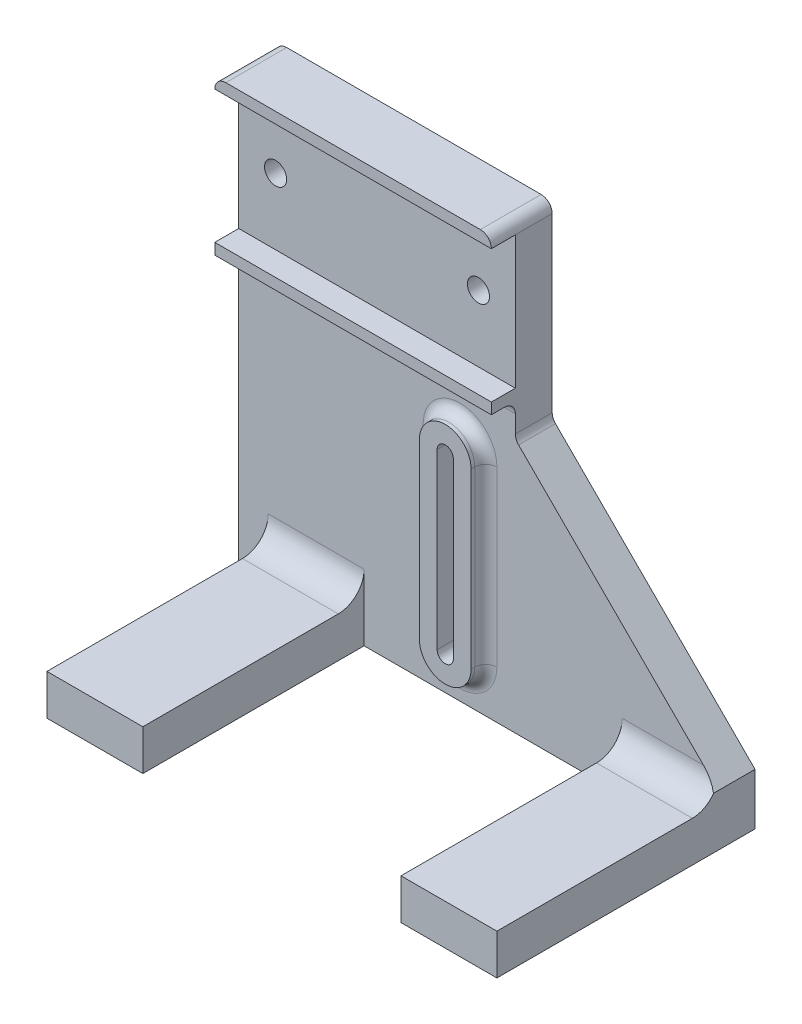
from build123d import *

# Parameters (mm, degrees)
BOSS_EXTRUDE1_DEPTH = 10
SKETCH3_W           = 75
SKETCH3_H           = 3
BOSS_EXTRUDE2_DEPTH = 6.5
SKETCH4_R           = 3
CUT_EXTRUDE2_DEPTH  = 10
SKETCH5_W           = 26
SKETCH5_H           = 11
BOSS_EXTRUDE3_DEPTH = 60
BOSS_EXTRUDE5_DEPTH = 4
CUT_EXTRUDE3_DEPTH  = 186.569394028
FILLET2_START       = -10
FILLET2_DEPTH       = 10
FILLET2_2_DEPTH     = 75
FILLET2_START_2     = -11
FILLET2_3_DEPTH     = 18
CUT_EXTRUDE5_DEPTH  = 7.75
FILLET4_R           = 3
FILLET5_R           = 7


with BuildPart() as part:
    # Sketch2 → Boss-Extrude1 (new body)
    with BuildSketch(Plane.XY):
        Polygon((0, 0), (130, 0), (130, 14), (75, 69), (75, 120), (0, 120), align=None)
    extrude(amount=-BOSS_EXTRUDE1_DEPTH)

    # Sketch3 → Boss-Extrude2 (add)
    with BuildSketch(Plane.XY):
        with Locations((37.5, 118.5)):
            Rectangle(SKETCH3_W, SKETCH3_H)
        with Locations((37.5, 79.5)):
            Rectangle(SKETCH3_W, SKETCH3_H)
    extrude(amount=BOSS_EXTRUDE2_DEPTH)

    # Sketch4 → Cut-Extrude2 (cut)
    with BuildSketch(Plane.XY):
        with Locations((10, 99)):
            Circle(SKETCH4_R)
        with Locations((65, 99)):
            Circle(SKETCH4_R)
    extrude(amount=-CUT_EXTRUDE2_DEPTH, mode=Mode.SUBTRACT)

    # Sketch5 → Boss-Extrude3 (add)
    with BuildSketch(Plane.XY):
        with Locations((117, 5.5)):
            Rectangle(SKETCH5_W, SKETCH5_H)
        with Locations((21, 5.5)):
            Rectangle(SKETCH5_W, SKETCH5_H)
    extrude(amount=BOSS_EXTRUDE3_DEPTH)

    # Sketch7 → Boss-Extrude5 (add)
    with BuildSketch(Plane.XY):
        with BuildLine():
            Line((53, 13), (53, 60))
            ThreePointArc((53, 60), (60, 67), (67, 60))
            Line((67, 60), (67, 13))
            ThreePointArc((67, 13), (60, 6), (53, 13))
        make_face()
    extrude(amount=BOSS_EXTRUDE5_DEPTH)

    # Sketch8 → Cut-Extrude3 (cut, through all)
    with BuildSketch(Plane.XY.offset(4)):
        with BuildLine():
            Line((62.2, 13), (62.2, 60))
            ThreePointArc((62.2, 60), (60, 62.2), (57.8, 60))
            Line((57.8, 60), (57.8, 13))
            ThreePointArc((57.8, 13), (60, 10.8), (62.2, 13))
        make_face()
    extrude(amount=-CUT_EXTRUDE3_DEPTH, mode=Mode.SUBTRACT)

    # Fillet2: read off the stored shape, not the designer's step
    # Fillet2 outline → Fillet2 (add)
    with BuildSketch(Plane.XY.offset(FILLET2_START)):
        with BuildLine():
            ThreePointArc((75.878679656, 68.121320344), (75.228361402, 69.09459039), (75, 70.242640687))
            Line((75, 70.242640687), (75, 69))
            Line((75, 69), (75.878679656, 68.121320344))
        make_face()
    extrude(amount=FILLET2_DEPTH)

    # Fillet2 2 outline → Fillet2 2 (add)
    with BuildSketch(Plane.YZ):
        with BuildLine():
            ThreePointArc((78, 3), (77.121320344, 0.878679656), (75, 0))
            Line((75, 0), (78, 0))
            Line((78, 0), (78, 3))
        make_face()
    extrude(amount=FILLET2_2_DEPTH)

    # Fillet2 3 outline → Fillet2 3 (cut)
    with BuildSketch(Plane.XY.offset(FILLET2_START_2)):
        with BuildLine():
            ThreePointArc((0, 117), (0.878679656, 119.121320344), (3, 120))
            Line((3, 120), (0, 120))
            Line((0, 120), (0, 117))
        make_face()
        with BuildLine():
            ThreePointArc((72, 120), (74.121320344, 119.121320344), (75, 117))
            Line((75, 117), (75, 120))
            Line((75, 120), (72, 120))
        make_face()
    extrude(amount=FILLET2_3_DEPTH, mode=Mode.SUBTRACT)

    # Sketch9 → Cut-Extrude5 (cut)
    with BuildSketch(Plane(origin=(0, 0, -10), x_dir=(-1, 0, 0), z_dir=(0, 0, -1))):
        with BuildLine():
            Line((-64, 60), (-64, 13))
            ThreePointArc((-64, 13), (-60, 9), (-56, 13))
            Line((-56, 13), (-56, 60))
            ThreePointArc((-56, 60), (-60, 64), (-64, 60))
        make_face()
    extrude(amount=-CUT_EXTRUDE5_DEPTH, mode=Mode.SUBTRACT)

    # Fillet4
    fillet4_edges = [part.edges().sort_by_distance(p)[0] for p in [
        (60, 6, 0),
        (67, 36.5, 0),
        (60, 67, 0),
        (53, 36.5, 0),
    ]]
    fillet(fillet4_edges, radius=FILLET4_R)

    # Fillet5
    fillet5_edges = [part.edges().sort_by_distance(p)[0] for p in [
        (117, 11, 0),
        (21, 11, 0),
    ]]
    fillet(fillet5_edges, radius=FILLET5_R)


solid = part.part
